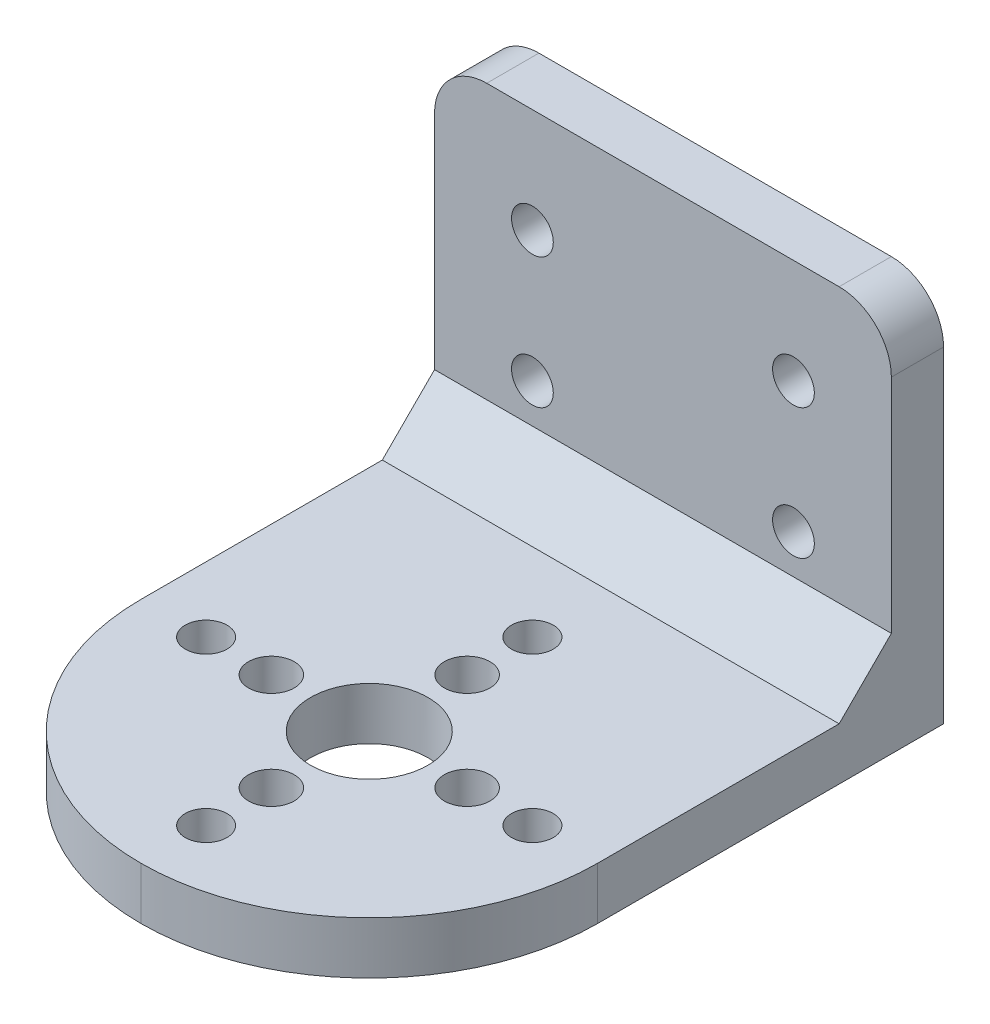
from build123d import *

# Parameters (mm, degrees)
SKETCH_1_W          = 35
SKETCH_1_H          = 44
EXTRUDE_1_DEPTH     = 4
SKETCH_2_W          = 35
SKETCH_2_H          = 4
EXTRUDE_2_DEPTH     = 25
SKETCH_3_R          = 4.5
SKETCH_3_R_2        = 1.75
SKETCH_3_R_3        = 1.6
CUT_EXTRUDE_1_DEPTH = 20
CHAMFER_1_SIZE      = 4
SKETCH_5_R          = 1.6
CUT_EXTRUDE_2_DEPTH = 20
FILLET_1_R          = 17.5
FILLET_2_R          = 4


with BuildPart() as part:
    # 草图1 → 凸台-拉伸1 (new body)
    with BuildSketch(Plane(origin=(0, 0, 0), x_dir=(1, 0, 0), z_dir=(0, 1, 0))):
        with Locations((17.5, 22)):
            Rectangle(SKETCH_1_W, SKETCH_1_H)
    extrude(amount=EXTRUDE_1_DEPTH)

    # 草图2 → 凸台-拉伸2 (add)
    with BuildSketch(Plane(origin=(0, 4, 0), x_dir=(1, 0, 0), z_dir=(0, 1, 0))):
        with Locations((17.5, 42)):
            Rectangle(SKETCH_2_W, SKETCH_2_H)
    extrude(amount=EXTRUDE_2_DEPTH)

    # 草图3 → 切除-拉伸1 (cut)
    with BuildSketch(Plane(origin=(0, 4, 0), x_dir=(1, 0, 0), z_dir=(0, 1, 0))):
        with Locations(Location((17.5, 17.5, 0), (0, 0, 270))):
            Circle(SKETCH_3_R)
        with Locations(Location((17.5, 25, 0), (0, 0, 270))):
            Circle(SKETCH_3_R_2)
        with Locations(Location((25, 17.5, 0), (0, 0, 270))):
            Circle(SKETCH_3_R_2)
        with Locations(Location((10, 17.5, 0), (0, 0, 270))):
            Circle(SKETCH_3_R_2)
        with Locations(Location((17.5, 10, 0), (0, 0, 270))):
            Circle(SKETCH_3_R_2)
        with Locations(Location((17.5, 30, 0), (0, 0, 270))):
            Circle(SKETCH_3_R_3)
        with Locations(Location((30, 17.5, 0), (0, 0, 270))):
            Circle(SKETCH_3_R_3)
        with Locations(Location((17.5, 5, 0), (0, 0, 270))):
            Circle(SKETCH_3_R_3)
        with Locations(Location((5, 17.5, 0), (0, 0, 270))):
            Circle(SKETCH_3_R_3)
    extrude(amount=-CUT_EXTRUDE_1_DEPTH, mode=Mode.SUBTRACT)

    # 倒角1
    chamfer_1_edges = [part.edges().sort_by_distance(p)[0] for p in [
        (17.5, 4, -40),
    ]]
    chamfer(chamfer_1_edges, length=CHAMFER_1_SIZE)

    # 草图5 → 切除-拉伸2 (cut)
    with BuildSketch(Plane.XY.offset(-40)):
        with Locations((7.5, 21)):
            Circle(SKETCH_5_R)
        with Locations((27.5, 21)):
            Circle(SKETCH_5_R)
        with Locations((27.5, 11)):
            Circle(SKETCH_5_R)
        with Locations((7.5, 11)):
            Circle(SKETCH_5_R)
    extrude(amount=-CUT_EXTRUDE_2_DEPTH, mode=Mode.SUBTRACT)

    # 圆角1
    fillet_1_edges = [part.edges().sort_by_distance(p)[0] for p in [
        (35, 2, 0),
        (0, 2, 0),
    ]]
    fillet(fillet_1_edges, radius=FILLET_1_R - 0.0001)  # a hair under: the kernel refuses the full size

    # 圆角2
    fillet_2_edges = [part.edges().sort_by_distance(p)[0] for p in [
        (0, 29, -42),
        (35, 29, -42),
    ]]
    fillet(fillet_2_edges, radius=FILLET_2_R)


solid = part.part
